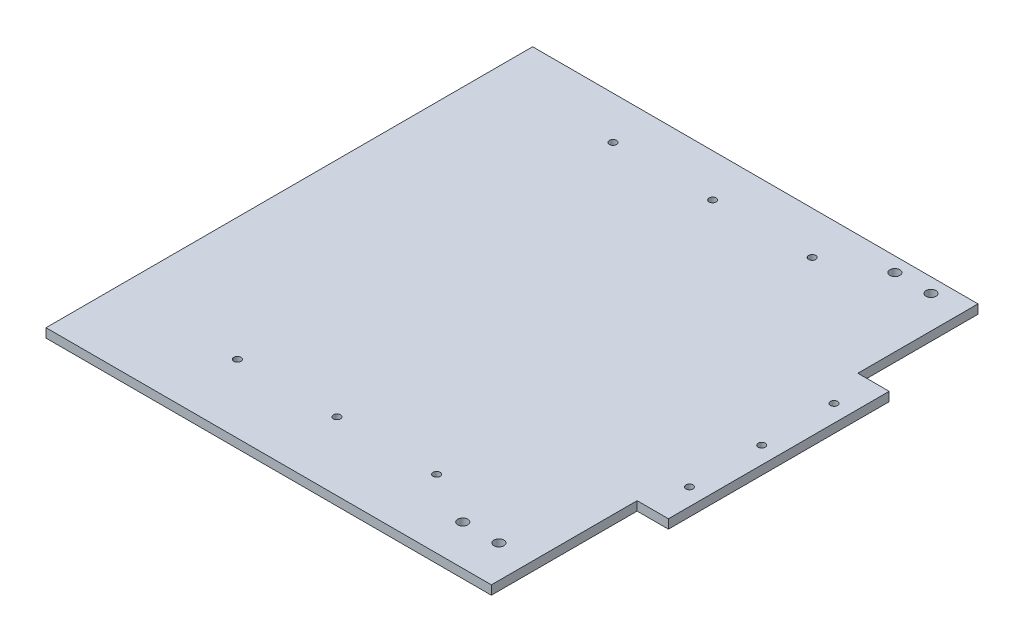
from build123d import *

# Parameters (mm, degrees)
SKETCH1_W           = 313
SKETCH1_H           = 342
BOSS_EXTRUDE1_DEPTH = 6.35
SKETCH3_W           = 22
SKETCH3_H           = 155.14040353
SKETCH3_R           = 2.5
BOSS_EXTRUDE2_DEPTH = 6.35
SKETCH2_R           = 2.5
CUT_EXTRUDE1_DEPTH  = 248.272263912
SKETCH4_R           = 3.5
CUT_EXTRUDE2_DEPTH  = 248.272263912


with BuildPart() as part:
    # Sketch1 → Boss-Extrude1 (new body)
    with BuildSketch(Plane(origin=(0, 0, 0), x_dir=(1, 0, 0), z_dir=(0, 1, 0))):
        Rectangle(SKETCH1_W, SKETCH1_H)
    extrude(amount=-BOSS_EXTRUDE1_DEPTH)

    # Sketch3 → Boss-Extrude2 (add)
    with BuildSketch(Plane(origin=(0, 0, 0), x_dir=(1, 0, 0), z_dir=(0, 1, 0))):
        with Locations((167.5, 9)):
            Rectangle(SKETCH3_W, SKETCH3_H)
        with Locations((166.5, 9)):
            Circle(SKETCH3_R, mode=Mode.SUBTRACT)
        with Locations((166.5, -41.8)):
            Circle(SKETCH3_R, mode=Mode.SUBTRACT)
        with Locations((166.5, 59.8)):
            Circle(SKETCH3_R, mode=Mode.SUBTRACT)
    extrude(amount=-BOSS_EXTRUDE2_DEPTH)

    # Sketch2 → Cut-Extrude1 (cut, through all)
    with BuildSketch(Plane(origin=(0, 0, 0), x_dir=(1, 0, 0), z_dir=(0, 1, 0))):
        with Locations((0, -123)):
            Circle(SKETCH2_R)
        with Locations((-70, -123)):
            Circle(SKETCH2_R)
        with Locations((70, -123)):
            Circle(SKETCH2_R)
        with Locations((-70, 141)):
            Circle(SKETCH2_R)
        with Locations((0, 141)):
            Circle(SKETCH2_R)
        with Locations((70, 141)):
            Circle(SKETCH2_R)
    extrude(amount=-CUT_EXTRUDE1_DEPTH, mode=Mode.SUBTRACT)

    # Sketch4 → Cut-Extrude2 (cut, through all)
    with BuildSketch(Plane(origin=(0, 0, 0), x_dir=(1, 0, 0), z_dir=(0, 1, 0))):
        with Locations((133.64, -142.84)):
            Circle(SKETCH4_R)
        with Locations((108.24, -142.84)):
            Circle(SKETCH4_R)
    cut_extrude2 = extrude(amount=-CUT_EXTRUDE2_DEPTH, mode=Mode.SUBTRACT)

    # Mirror1: Cut-Extrude2 across plane
    add(cut_extrude2.mirror(Plane(origin=(0, 0, -9), x_dir=(1, 0, 0), z_dir=(0, 0, -1))), mode=Mode.SUBTRACT)


solid = part.part
